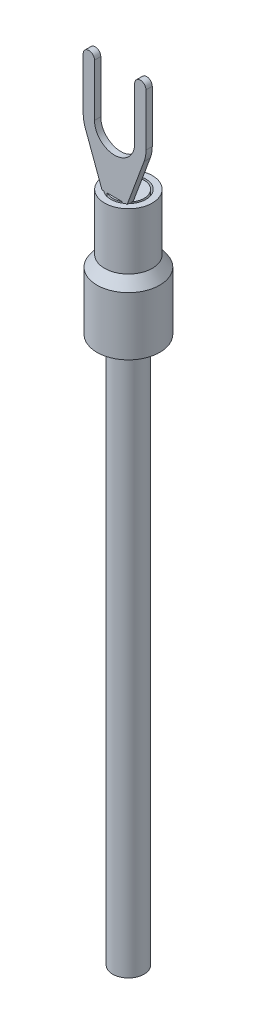
from build123d import *

# Parameters (mm, degrees)
EXTRUDE_1_DEPTH               = 0.5
FILLET_1_RADIUS               = 0.45
FILLET_1_LENGTH               = 0.5
CHAMFER_1_SIZE                = 0.5
FILLET_1_OF_MIRROR_1_2_RADIUS = 0.45
FILLET_1_OF_MIRROR_1_2_LENGTH = 0.5
CHAMFER_1_OF_MIRROR_1_SIZE    = 0.5
SKETCH_5_R                    = 1.25
EXTRUDE_2_DEPTH               = 53.5


with BuildPart() as part:
    # 草图1 → 凸台-拉伸1 (new body)
    with BuildSketch(Plane.XY):
        with BuildLine():
            Line((-2.344520595, -0.867884312), (-1, -4.5))
            Line((-1, -4.5), (-1, -14.5))
            Line((-1, -14.5), (0, -14.5))
            Line((0, -14.5), (0, -1.6))
            ThreePointArc((0, -1.6), (-1.13137085, -1.13137085), (-1.6, 0))
            Line((-1.6, 0), (-1.6, 4.6))
            Line((-1.6, 4.6), (-2.5, 4.6))
            Line((-2.5, 4.6), (-2.5, 0))
            ThreePointArc((-2.5, 0), (-2.460823184, -0.440850605), (-2.344520595, -0.867884312))
        make_face()
    extrude_1 = extrude(amount=EXTRUDE_1_DEPTH)

    # 圆角1: full round fillet: the end face becomes a half cylinder, R = half its width
    fillet_1_face = Plane((-2.05, 4.6, 0.25), x_dir=(0, 0, 1), z_dir=(0, 1, 0))  # on the end face: x along it, z out of the body
    fillet_1_slab = fillet_1_face.offset(-FILLET_1_RADIUS / 2) * Box(FILLET_1_LENGTH, 2 * FILLET_1_RADIUS, FILLET_1_RADIUS, mode=Mode.PRIVATE)  # the body's end, R deep
    fillet_1_round = Plane((-2.05, 4.15, 0.25), x_dir=(0, 1, 0), z_dir=(0, 0, 1)) * Cylinder(FILLET_1_RADIUS, FILLET_1_LENGTH, mode=Mode.PRIVATE)  # its axis R under the face
    add(fillet_1_slab - fillet_1_round, mode=Mode.SUBTRACT)

    # 倒角1
    chamfer_1_edges = [part.edges().sort_by_distance(p)[0] for p in [
        (-1, -9.5, 0.5),
    ]]
    chamfer(chamfer_1_edges, length=CHAMFER_1_SIZE - 0.0001)  # a hair under: the kernel refuses the full size

    # 镜向1: 凸台-拉伸1 across Right Plane
    add(extrude_1.mirror(Plane(origin=(0, 0, 0), x_dir=(0, 0, -1), z_dir=(1, 0, 0))))

    # 圆角1 of Mirror 1 2: full round fillet: the end face becomes a half cylinder, R = half its width
    fillet_1_of_mirror_1_2_face = Plane((2.05, 4.6, 0.25), x_dir=(0, 0, 1), z_dir=(0, 1, 0))  # on the end face: x along it, z out of the body
    fillet_1_of_mirror_1_2_slab = fillet_1_of_mirror_1_2_face.offset(-FILLET_1_OF_MIRROR_1_2_RADIUS / 2) * Box(FILLET_1_OF_MIRROR_1_2_LENGTH, 2 * FILLET_1_OF_MIRROR_1_2_RADIUS, FILLET_1_OF_MIRROR_1_2_RADIUS, mode=Mode.PRIVATE)  # the body's end, R deep
    fillet_1_of_mirror_1_2_round = Plane((2.05, 4.15, 0.25), x_dir=(0, 1, 0), z_dir=(0, 0, 1)) * Cylinder(FILLET_1_OF_MIRROR_1_2_RADIUS, FILLET_1_OF_MIRROR_1_2_LENGTH, mode=Mode.PRIVATE)  # its axis R under the face
    add(fillet_1_of_mirror_1_2_slab - fillet_1_of_mirror_1_2_round, mode=Mode.SUBTRACT)

    # 倒角1 of 镜向1
    chamfer_1_of_mirror_1_edges = [part.edges().sort_by_distance(p)[0] for p in [
        (1, -9.5, 0.5),
    ]]
    chamfer(chamfer_1_of_mirror_1_edges, length=CHAMFER_1_OF_MIRROR_1_SIZE - 0.0001)  # a hair under: the kernel refuses the full size

    # 草图3 → 旋转1 (revolve)
    with BuildSketch(Plane(origin=(0, 0, 0), x_dir=(0, 0, -1), z_dir=(1, 0, 0)), mode=Mode.PRIVATE) as revolve_1_sk:
        Polygon((2.5, -4.5), (2.5, -9.004043198), (3.1, -9.860932002), (3.1, -14.5), (2.6, -14.5), (2.6, -10.018581397), (2, -9.161692593), (2, -4.5), align=None)
    revolve(revolve_1_sk.sketch.rotate(Axis((0, -5.567856156, -0.6), (0, -1, 0)), 180), axis=Axis((0, -5.567856156, -0.6), (0, -1, 0)))

    # 草图5 → 凸台-拉伸2 (add)
    with BuildSketch(Plane(origin=(0, -4.5, 0), x_dir=(1, 0, 0), z_dir=(0, 1, 0))):
        with Locations(Location((0, 0.6, 0), (0, 0, 270))):
            Circle(SKETCH_5_R)
    extrude(amount=-EXTRUDE_2_DEPTH)


solid = part.part
